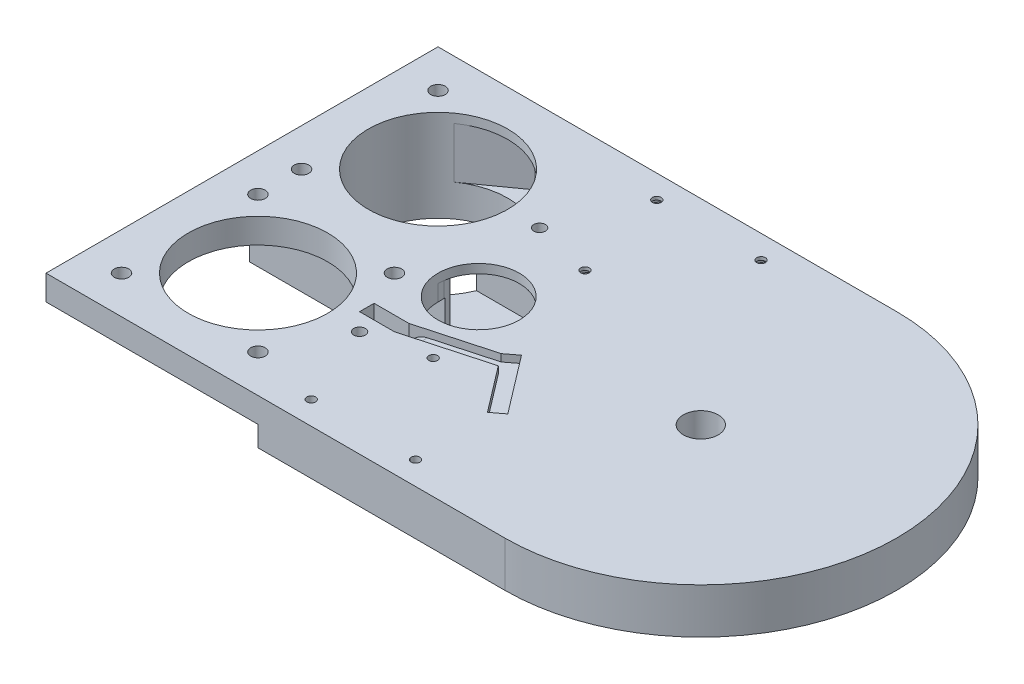
from build123d import *

# Parameters (mm, degrees)
SALIENTE_EXTRUIR4_DEPTH    = 8.6
SALIENTE_EXTRUIR2_DEPTH    = 23
CORTAR_EXTRUIR1_DEPTH      = 174.347194959
CORTAR_EXTRUIR1_DEPTH_BACK = 174.347194959
CROQUIS2_R                 = 14
CROQUIS2_R_2               = 24
CROQUIS5_R                 = 2.5
CORTAR_EXTRUIR2_DEPTH      = 175.696336539
SALIENTE_EXTRUIR3_START    = -15.6
SALIENTE_EXTRUIR3_DEPTH    = 15.6
CORTAR_EXTRUIR3_DEPTH      = 174.347194959
CORTAR_EXTRUIR3_DEPTH_BACK = 174.347194959
CROQUIS7_R                 = 6
CORTAR_EXTRUIR4_DEPTH      = 5
CORTAR_EXTRUIR4_DEPTH_BACK = 12.5
REDONDEO1_R                = 2
CROQUIS9_R                 = 16.85
CROQUIS9_R_2               = 6
SALIENTE_EXTRUIR5_DEPTH    = 4.65
CROQUIS10_R                = 10
CROQUIS10_R_2              = 6
SALIENTE_EXTRUIR6_DEPTH    = 29
REDONDEO2_R                = 0.5
REDONDEO3_R                = 2
SALIENTE_EXTRUIR7_REACH    = 177.079
CROQUIS12_R                = 1.5
CORTAR_EXTRUIR5_DEPTH      = 174.111445318
CORTAR_EXTRUIR6_DEPTH      = 2
CROQUIS14_R                = 3
CORTAR_EXTRUIR7_DEPTH      = 3.7
CROQUIS15_R                = 2
CORTAR_EXTRUIR8_DEPTH      = 175.696336539
CROQUIS16_R                = 4
CORTAR_EXTRUIR9_DEPTH      = 4
CORTAR_EXTRUIR10_DEPTH     = 10
CORTAR_EXTRUIR11_DEPTH     = 2.5
CROQUIS20_W                = 12
CROQUIS20_H                = 5
CORTAR_EXTRUIR12_DEPTH     = 176.700917755
REDONDEO4_R                = 5


with BuildPart() as part:
    # Croquis1 → Saliente-Extruir4 (new body)
    with BuildSketch(Plane(origin=(0, 0, 0), x_dir=(1, 0, 0), z_dir=(0, 1, 0))):
        with BuildLine():
            Line((0, -67.5), (-158, -67.5))
            Line((-158, -67.5), (-158, 67.5))
            Line((-158, 67.5), (0, 67.5))
            ThreePointArc((0, 67.5), (67.5, 0), (0, -67.5))
        make_face()
    extrude(amount=SALIENTE_EXTRUIR4_DEPTH)

    # Croquis3 → Saliente-Extruir2 (add)
    with BuildSketch(Plane.XZ):
        Polygon((-85, -67.5), (-68.148148148, -2.5), (-158, -2.5), (-158, -67.5), align=None)
    extrude(amount=SALIENTE_EXTRUIR2_DEPTH)

    # Croquis2 → Cortar-Extruir1 (cut, two sides: drawn at the far end of the back side and taken through both)
    with BuildSketch(Plane(origin=(0, 0, 0), x_dir=(1, 0, 0), z_dir=(0, 1, 0)).offset(-CORTAR_EXTRUIR1_DEPTH_BACK)):
        with Locations(Location((-76.5, 0, 0), (0, 0, 66.051358792))):
            Circle(CROQUIS2_R)
        with Locations(Location((-121.5, 31, 0), (0, 0, 90))):
            Circle(CROQUIS2_R_2)
        with Locations(Location((-121.5, -31, 0), (0, 0, 90))):
            Circle(CROQUIS2_R_2)
    extrude(amount=CORTAR_EXTRUIR1_DEPTH + CORTAR_EXTRUIR1_DEPTH_BACK, mode=Mode.SUBTRACT)

    # Croquis5 → Cortar-Extruir2 (cut, through all)
    with BuildSketch(Plane(origin=(0, 8.6, 0), x_dir=(1, 0, 0), z_dir=(0, 1, 0))):
        with Locations(Location((-145, -7.5, 0), (0, 0, 270))):
            Circle(CROQUIS5_R)
        with Locations(Location((-145, -54.5, 0), (0, 0, 270))):
            Circle(CROQUIS5_R)
        with Locations(Location((-98, -54.5, 0), (0, 0, 270))):
            Circle(CROQUIS5_R)
        with Locations(Location((-98, -7.5, 0), (0, 0, 270))):
            Circle(CROQUIS5_R)
        with Locations(Location((-145, 7.5, 0), (0, 0, 270))):
            Circle(CROQUIS5_R)
        with Locations(Location((-145, 54.5, 0), (0, 0, 270))):
            Circle(CROQUIS5_R)
    extrude(amount=-CORTAR_EXTRUIR2_DEPTH, mode=Mode.SUBTRACT)

    # Croquis6 → Saliente-Extruir3 (add)
    with BuildSketch(Plane(origin=(0, 8.6, 0), x_dir=(1, 0, 0), z_dir=(0, 1, 0)).offset(SALIENTE_EXTRUIR3_START)):
        with BuildLine():
            Line((0, -67.5), (-85, -67.5))
            Line((-85, -67.5), (-70.817153658, -12.794735536))
            ThreePointArc((-70.817153658, -12.794735536), (-62.5, 0), (-70.817153658, 12.794735536))
            Line((-70.817153658, 12.794735536), (-85, 67.5))
            Line((-85, 67.5), (0, 67.5))
            ThreePointArc((0, 67.5), (67.5, 0), (0, -67.5))
        make_face()
    extrude(amount=SALIENTE_EXTRUIR3_DEPTH)

    # Croquis7 → Cortar-Extruir3 (cut, two sides: drawn at the far end of the back side and taken through both)
    with BuildSketch(Plane(origin=(0, 0, 0), x_dir=(1, 0, 0), z_dir=(0, 1, 0)).offset(-CORTAR_EXTRUIR3_DEPTH_BACK)):
        with Locations(Location((0, 0, 0), (0, 0, 270))):
            Circle(CROQUIS7_R)
    extrude(amount=CORTAR_EXTRUIR3_DEPTH + CORTAR_EXTRUIR3_DEPTH_BACK, mode=Mode.SUBTRACT)

    # Croquis8 → Cortar-Extruir4 (cut, two sides: drawn at the far end of the back side and taken through both)
    with BuildSketch(Plane.XZ.offset(7).offset(-CORTAR_EXTRUIR4_DEPTH_BACK)):
        with BuildLine():
            Line((0, -63), (-116.397014468, -63))
            ThreePointArc((-116.397014468, -63), (-117.923471798, -62.761294784), (-119.304179798, -62.067971208))
            Line((-119.304179798, -62.067971208), (-135.454393581, -50.526261798))
            ThreePointArc((-135.454393581, -50.526261798), (-144.354214963, -23.673004816), (-121.5, -7))
            Line((-121.5, -7), (-95.5, -7))
            ThreePointArc((-95.5, -7), (-91.964466094, -5.535533906), (-90.5, -2))
            Line((-90.5, -2), (-90.5, 0))
            ThreePointArc((-90.5, 0), (-84.130208097, 11.737969347), (-70.817153658, 12.794735536))
            ThreePointArc((-70.817153658, 12.794735536), (-69.810181657, 12.29822469), (-68.84623323, 11.722621474))
            ThreePointArc((-68.84623323, 11.722621474), (-64.266892893, 11.262463458), (-61.251513841, 14.739472589))
            ThreePointArc((-61.251513841, 14.739472589), (49.485284546, 38.989827051), (0, -63))
        make_face()
    extrude(amount=CORTAR_EXTRUIR4_DEPTH + CORTAR_EXTRUIR4_DEPTH_BACK, mode=Mode.SUBTRACT)


with BuildPart() as cortar_extruir4_kept_piece:
    # of the separate pieces the step leaves, the one the design keeps (cortar_extruir4_pieces_kept)
    add(part.part.solids().sort_by_distance((0, 8.6, 67.5))[0])

    # Redondeo1
    redondeo1_edges = [cortar_extruir4_kept_piece.edges().sort_by_distance(p)[0] for p in [
        (-70.817153658, -17.5, -12.794735536),
    ]]
    fillet(redondeo1_edges, radius=REDONDEO1_R)

    # Croquis9 → Saliente-Extruir5 (add)
    with BuildSketch(Plane.XZ.offset(-5.5)):
        with Locations(Location((0, 0, 0), (0, 0, 270))):
            Circle(CROQUIS9_R)
        with Locations(Location((0, 0, 0), (0, 0, 90))):
            Circle(CROQUIS9_R_2, mode=Mode.SUBTRACT)
    extrude(amount=SALIENTE_EXTRUIR5_DEPTH)

    # Croquis10 → Saliente-Extruir6 (add)
    with BuildSketch(Plane.XZ.offset(-0.85)):
        with Locations(Location((0, 0, 0), (0, 0, 90))):
            Circle(CROQUIS10_R)
        with Locations(Location((0, 0, 0), (0, 0, 90))):
            Circle(CROQUIS10_R_2, mode=Mode.SUBTRACT)
    extrude(amount=SALIENTE_EXTRUIR6_DEPTH)

    # Redondeo2
    redondeo2_edges = [cortar_extruir4_kept_piece.edges().sort_by_distance(p)[0] for p in [
        (0, 0.85, 16.85),
    ]]
    fillet(redondeo2_edges, radius=REDONDEO2_R)

    # Redondeo3
    redondeo3_edges = [cortar_extruir4_kept_piece.edges().sort_by_distance(p)[0] for p in [
        (0, 5.5, 16.85),
    ]]
    fillet(redondeo3_edges, radius=REDONDEO3_R)

    # Croquis11 → Saliente-Extruir7 (add, up to next)
    with BuildSketch(Plane.XZ.offset(-5.5), mode=Mode.PRIVATE) as saliente_extruir7_sk1:
        with BuildLine():
            Line((-73.203703704, -22), (-77.87037037, -40))
            Line((-77.87037037, -40), (-99.251404539, -40))
            ThreePointArc((-99.251404539, -40), (-97.5, -31), (-99.251404539, -22))
            Line((-99.251404539, -22), (-73.203703704, -22))
        make_face()
    saliente_extruir7_tool1 = extrude(saliente_extruir7_sk1.sketch, amount=SALIENTE_EXTRUIR7_REACH, mode=Mode.PRIVATE) - cortar_extruir4_kept_piece.part
    add(saliente_extruir7_tool1.solids().sort_by_distance((-86.771742, 5.5, -30.689413))[0])

    # Croquis12 → Cortar-Extruir5 (cut, through all)
    with BuildSketch(Plane.XZ.offset(7)):
        with Locations(Location((-74.661436633, 59.5, 0), (0, 0, 270))):
            Circle(CROQUIS12_R)
        with Locations(Location((-66.012679429, 26.140507926, 0), (0, 0, 270))):
            Circle(CROQUIS12_R)
        with Locations(Location((-38.73951471, 59.5, 0), (0, 0, 270))):
            Circle(CROQUIS12_R)
        with Locations(Location((-38.73951471, -59.5, 0), (0, 0, 270))):
            Circle(CROQUIS12_R)
        with Locations(Location((-74.661436633, -59.5, 0), (0, 0, 270))):
            Circle(CROQUIS12_R)
        with Locations(Location((-66.012679429, -26.140507926, 0), (0, 0, 270))):
            Circle(CROQUIS12_R)
    extrude(amount=-CORTAR_EXTRUIR5_DEPTH, mode=Mode.SUBTRACT)

    # Croquis13 → Cortar-Extruir6 (cut)
    with BuildSketch(Plane.XZ.offset(-5.5)):
        Polygon((-70.908659884, -59.5), (-72.785048259, -56.25), (-76.537825008, -56.25), (-78.414213383, -59.5), (-76.537825008, -62.75), (-72.785048259, -62.75), align=None)
        Polygon((-62.259902679, -26.140507926), (-64.136291054, -22.890507926), (-67.889067804, -22.890507926), (-69.765456179, -26.140507926), (-67.889067804, -29.390507926), (-64.136291054, -29.390507926), align=None)
        Polygon((-34.986737961, -59.5), (-36.863126336, -56.25), (-40.615903085, -56.25), (-42.49229146, -59.5), (-40.615903085, -62.75), (-36.863126336, -62.75), align=None)
    extrude(amount=-CORTAR_EXTRUIR6_DEPTH, mode=Mode.SUBTRACT)

    # Croquis14 → Cortar-Extruir7 (cut)
    with BuildSketch(Plane.XZ.offset(7)):
        with Locations(Location((-66.012679429, 26.140507926, 0), (0, 0, 270))):
            Circle(CROQUIS14_R)
        with Locations(Location((-74.661436633, 59.5, 0), (0, 0, 270))):
            Circle(CROQUIS14_R)
        with Locations(Location((-38.73951471, 59.5, 0), (0, 0, 270))):
            Circle(CROQUIS14_R)
    extrude(amount=-CORTAR_EXTRUIR7_DEPTH, mode=Mode.SUBTRACT)

    # Croquis15 → Cortar-Extruir8 (cut, through all)
    with BuildSketch(Plane.XZ.offset(23)):
        with Locations(Location((-86.518518519, -31, 0), (0, 0, 270))):
            Circle(CROQUIS15_R)
        with Locations(Location((-86.518518519, 31, 0), (0, 0, 90))):
            Circle(CROQUIS15_R)
    extrude(amount=-CORTAR_EXTRUIR8_DEPTH, mode=Mode.SUBTRACT)

    # Croquis16 → Cortar-Extruir9 (cut)
    with BuildSketch(Plane.XZ):
        with Locations(Location((-86.518518519, 31, 0), (0, 0, 270))):
            Circle(CROQUIS16_R)
    extrude(amount=-CORTAR_EXTRUIR9_DEPTH, mode=Mode.SUBTRACT)

    # Croquis17 → Cortar-Extruir10 (cut)
    with BuildSketch(Plane.XZ.offset(23)):
        Polygon((-82.1883915, -31), (-84.353455009, -27.25), (-88.683582028, -27.25), (-90.848645537, -31), (-88.683582028, -34.75), (-84.353455009, -34.75), align=None)
    extrude(amount=-CORTAR_EXTRUIR10_DEPTH, mode=Mode.SUBTRACT)

    # Croquis19 → Cortar-Extruir11 (cut)
    with BuildSketch(Plane(origin=(0, 8.6, 0), x_dir=(1, 0, 0), z_dir=(0, 1, 0))):
        Polygon((-52.482988664, -17.255771853), (-40.471682692, -33.003928572), (-36.496071428, -29.971682692), (-51.657300826, -10.09362637), (-55.63291209, -13.12587225), (-80.518518519, -20), (-92.518518519, -20), (-92.518518519, -25), (-80.518518519, -25), align=None)
    extrude(amount=-CORTAR_EXTRUIR11_DEPTH, mode=Mode.SUBTRACT)

    # Croquis20 → Cortar-Extruir12 (cut, through all)
    with BuildSketch(Plane(origin=(0, 8.6, 0), x_dir=(1, 0, 0), z_dir=(0, 1, 0))):
        with Locations((-86.518518519, -22.5)):
            Rectangle(CROQUIS20_W, CROQUIS20_H)
    extrude(amount=-CORTAR_EXTRUIR12_DEPTH, mode=Mode.SUBTRACT)

    # Redondeo4
    # the kernel refuses this fillet: 5 mm, written as the material it takes off along each edge
    with BuildSketch(Plane(origin=(-80.518518519, 6.1, 25), x_dir=(0, -1, 0), z_dir=(0, 0, -1))) as redondeo4_piece_1_section:
        with BuildLine():
            CenterArc((REDONDEO4_R, -REDONDEO4_R), REDONDEO4_R, 90, 90)
            Line((0, -REDONDEO4_R), (0, 0))
            Line((0, 0), (REDONDEO4_R, 0))
        make_face()
    redondeo4_piece_1 = extrude(amount=5, mode=Mode.PRIVATE)
    redondeo4_piece_1 = split(redondeo4_piece_1, bisect_by=Plane(origin=(-78.850583618, 4.928175606, 24.539267905), z_dir=(-0.26625771274306737, 0, -0.9639018779963188)), keep=Keep.TOP, mode=Mode.PRIVATE)
    redondeo4_piece_1 = split(redondeo4_piece_1, bisect_by=Plane(origin=(-80.133815165, 4.928175606, 19.893733753), z_dir=(0.2662577127430677, 0, 0.9639018779963188)), keep=Keep.TOP, mode=Mode.PRIVATE)
    add(redondeo4_piece_1, mode=Mode.SUBTRACT)
    with BuildSketch(Plane(origin=(-80.518518519, 6.1, 25), x_dir=(0, -1, 0), z_dir=(0, 0, -1))) as redondeo4_piece_2_section:
        with BuildLine():
            CenterArc((REDONDEO4_R, -REDONDEO4_R), REDONDEO4_R, 90, 90)
            Line((0, -REDONDEO4_R), (0, 0))
            Line((0, 0), (REDONDEO4_R, 0))
        make_face()
    redondeo4_piece_2 = extrude(amount=17.5, mode=Mode.PRIVATE)
    redondeo4_piece_2 = split(redondeo4_piece_2, bisect_by=Plane(origin=(-78.44415934, 5.567637436, 19.427001708), z_dir=(0.2662577127430677, 0, 0.9639018779963188)), keep=Keep.TOP, mode=Mode.PRIVATE)
    redondeo4_piece_2 = split(redondeo4_piece_2, bisect_by=Plane(origin=(-78.36792826, 5.567637436, 20), z_dir=(0, 0, -1)), keep=Keep.TOP, mode=Mode.PRIVATE)
    add(redondeo4_piece_2, mode=Mode.SUBTRACT)


solid = cortar_extruir4_kept_piece.part
